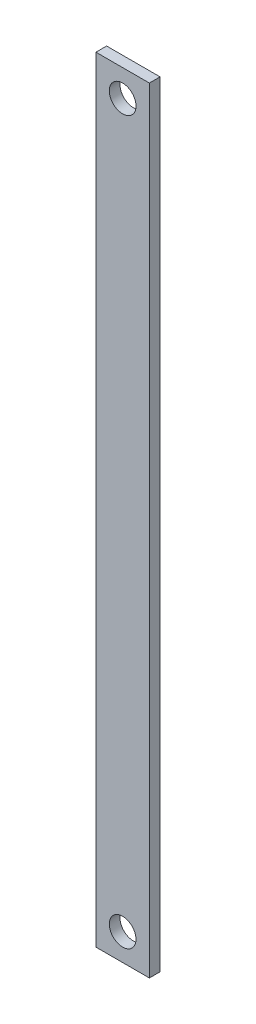
from build123d import *

# Parameters (mm, degrees)
SKETCH_1_W          = 20
SKETCH_1_H          = 4
EXTRUDE_1_DEPTH     = 290
SKETCH_2_R          = 5
CUT_EXTRUDE_1_DEPTH = 291.716356609


with BuildPart() as part:
    # Эскиз1 → Бобышка-Вытянуть1 (new body)
    with BuildSketch(Plane(origin=(0, 0, 0), x_dir=(1, 0, 0), z_dir=(0, 1, 0))):
        with Locations((10, 2)):
            Rectangle(SKETCH_1_W, SKETCH_1_H)
    extrude(amount=EXTRUDE_1_DEPTH)

    # Эскиз2 → Вырез-Вытянуть1 (cut, through all)
    with BuildSketch(Plane.XY):
        with Locations((10, 10)):
            Circle(SKETCH_2_R)
        with Locations((10, 280)):
            Circle(SKETCH_2_R)
    extrude(amount=-CUT_EXTRUDE_1_DEPTH, mode=Mode.SUBTRACT)


solid = part.part
